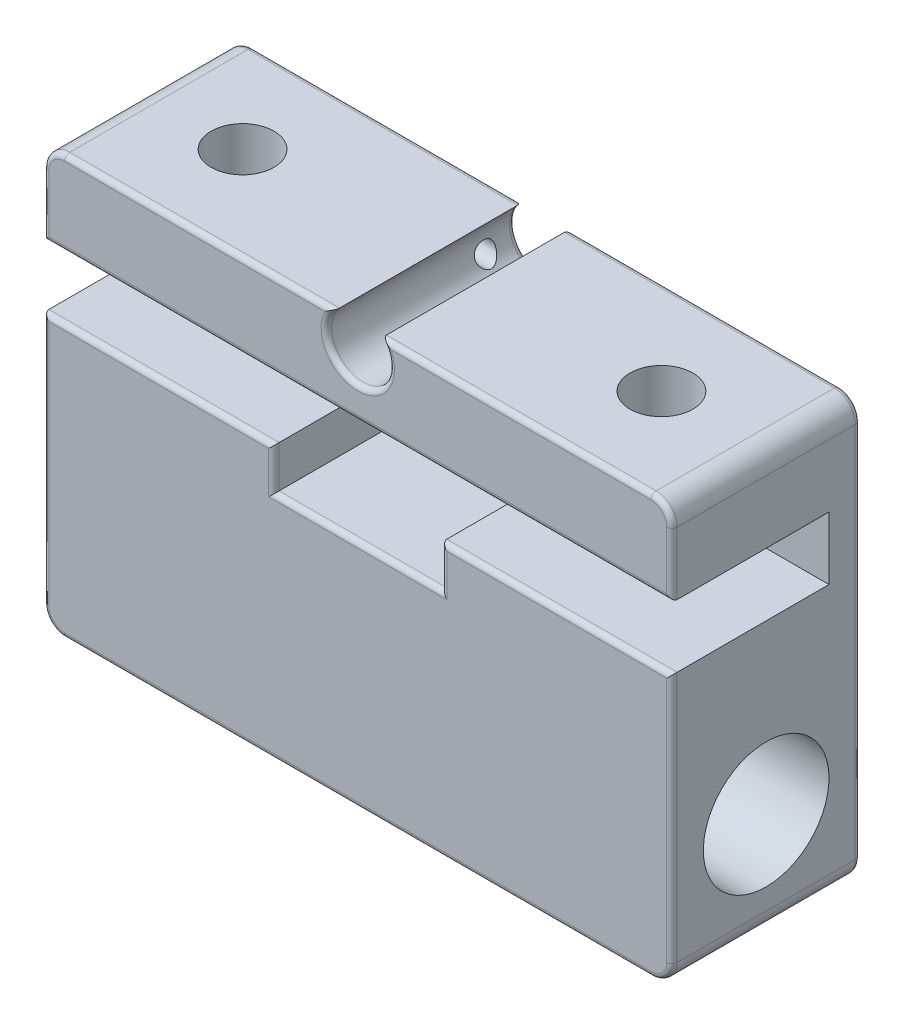
from build123d import *

# Parameters (mm, degrees)
SKETCH1_W           = 60
SKETCH1_H           = 40
BOSS_EXTRUDE1_DEPTH = 9
SKETCH2_R           = 6
CUT_EXTRUDE1_DEPTH  = 64.882705015
SKETCH3_R           = 3
CUT_EXTRUDE2_DEPTH  = 41.298883359
CUT_EXTRUDE3_DEPTH  = 15
SKETCH5_R           = 1
CUT_EXTRUDE4_DEPTH  = 29
SKETCH6_R           = 1.5
CUT_EXTRUDE5_DEPTH  = 5
CUT_EXTRUDE6_REACH  = 52.804
SKETCH7_R           = 2
SKETCH8_R           = 3
CUT_EXTRUDE7_DEPTH  = 5
FILLET1_R           = 2
FILLET2_R           = 0.5


with BuildPart() as part:
    # Sketch1 → Boss-Extrude1 (new, symmetric)
    with BuildSketch(Plane.XY):
        Rectangle(SKETCH1_W, SKETCH1_H)
    extrude(amount=BOSS_EXTRUDE1_DEPTH, both=True)

    # Sketch2 → Cut-Extrude1 (cut, through all)
    with BuildSketch(Plane.ZY.offset(30)):
        with Locations(Location((0, -10, 0), (0, 0, 270))):
            Circle(SKETCH2_R)
    extrude(amount=-CUT_EXTRUDE1_DEPTH, mode=Mode.SUBTRACT)

    # Sketch3 → Cut-Extrude2 (cut, through all)
    with BuildSketch(Plane.XY.offset(9)):
        with Locations((0, 18)):
            Circle(SKETCH3_R)
    extrude(amount=-CUT_EXTRUDE2_DEPTH, mode=Mode.SUBTRACT)

    # Sketch4 → Cut-Extrude3 (cut)
    with BuildSketch(Plane.XY.offset(9)):
        Polygon((-30, 12), (30, 12), (30, 6), (8, 6), (8, 2), (-8, 2), (-8, 6), (-30, 6), align=None)
    extrude(amount=-CUT_EXTRUDE3_DEPTH, mode=Mode.SUBTRACT)

    # Sketch5 → Cut-Extrude4 (cut)
    with BuildSketch(Plane.ZY.offset(30)):
        with Locations(Location((-6, 17, 0), (0, 0, 270))):
            Circle(SKETCH5_R)
    extrude(amount=-CUT_EXTRUDE4_DEPTH, mode=Mode.SUBTRACT)

    # Sketch6 → Cut-Extrude5 (cut)
    with BuildSketch(Plane.ZY.offset(30)):
        with Locations(Location((-6, 17, 0), (0, 0, 270))):
            Circle(SKETCH6_R)
    extrude(amount=-CUT_EXTRUDE5_DEPTH, mode=Mode.SUBTRACT)

    # Sketch7 → Cut-Extrude6 (cut, up to next)
    with BuildSketch(Plane(origin=(0, 20, 0), x_dir=(1, 0, 0), z_dir=(0, 1, 0)), mode=Mode.PRIVATE) as cut_extrude6_sk1:
        with Locations(Location((-20, 0, 0), (0, 0, 270))):
            Circle(SKETCH7_R)
    cut_extrude6_tool1 = extrude(cut_extrude6_sk1.sketch, amount=-CUT_EXTRUDE6_REACH, mode=Mode.PRIVATE) & part.part
    # Sketch7 → Cut-Extrude6 (cut, up to next)
    with BuildSketch(Plane(origin=(0, 20, 0), x_dir=(1, 0, 0), z_dir=(0, 1, 0)), mode=Mode.PRIVATE) as cut_extrude6_sk2:
        with Locations(Location((20, 0, 0), (0, 0, 270))):
            Circle(SKETCH7_R)
    cut_extrude6_tool2 = extrude(cut_extrude6_sk2.sketch, amount=-CUT_EXTRUDE6_REACH, mode=Mode.PRIVATE) & part.part
    add(cut_extrude6_tool1.solids().sort_by_distance((-20, 20, 0))[0], mode=Mode.SUBTRACT)
    add(cut_extrude6_tool2.solids().sort_by_distance((20, 20, 0))[0], mode=Mode.SUBTRACT)

    # Sketch8 → Cut-Extrude7 (cut)
    with BuildSketch(Plane(origin=(0, 20, 0), x_dir=(1, 0, 0), z_dir=(0, 1, 0))):
        with Locations(Location((-20, 0, 0), (0, 0, 270))):
            Circle(SKETCH8_R)
        with Locations(Location((20, 0, 0), (0, 0, 90))):
            Circle(SKETCH8_R)
    extrude(amount=-CUT_EXTRUDE7_DEPTH, mode=Mode.SUBTRACT)

    # Fillet1
    # the kernel refuses this fillet: 2 mm, written as the material it takes off along each edge
    with BuildSketch(Plane(origin=(30, -20, 14), x_dir=(-1, 0, 0), z_dir=(0, 0, -1))) as fillet1_piece_1:
        with BuildLine():
            CenterArc((FILLET1_R, FILLET1_R), FILLET1_R, 180, 90)
            Line((0, FILLET1_R), (0, 0))
            Line((0, 0), (FILLET1_R, 0))
        make_face()
    extrude(amount=28, mode=Mode.SUBTRACT)
    with BuildSketch(Plane(origin=(-30, -20, -14), x_dir=(0, 1, 0), z_dir=(0, 0, 1)), Plane(origin=(-30, 20, -14), x_dir=(1, 0, 0), z_dir=(0, 0, 1)), Plane(origin=(30, 20, 14), x_dir=(-1, 0, 0), z_dir=(0, 0, -1))) as fillet1_piece_2:
        with BuildLine():
            CenterArc((FILLET1_R, -FILLET1_R), FILLET1_R, 90, 90)
            Line((0, -FILLET1_R), (0, 0))
            Line((0, 0), (FILLET1_R, 0))
        make_face()
    extrude(amount=28, mode=Mode.SUBTRACT)

    # Fillet2
    fillet2_edges = [part.edges().sort_by_distance(p)[0] for p in [
        (29.414213562, -19.414213562, 9),
        (15.118033989, 20, 9),
        (-30, 15, 9),
        (-29.414213562, 19.414213562, 9),
        (29.414213562, 19.414213562, 9),
        (-15.118033989, 20, -9),
        (0, 15, -9),
        (-15.118033989, 20, 9),
        (0, 15, 9),
        (-30, -6, 9),
        (30, 15, 9),
        (-19, 6, 9),
        (-8, 4, 9),
        (0, 2, 9),
        (8, 4, 9),
        (19, 6, 9),
        (0, 12, 9),
        (30, -6, 9),
        (30, 0, -9),
        (15.118033989, 20, -9),
        (0, -20, -9),
        (-30, 0, -9),
        (-29.414213562, 19.414213562, -9),
        (-29.414213562, -19.414213562, -9),
        (29.414213562, 19.414213562, -9),
        (29.414213562, -19.414213562, -9),
        (0, -20, 9),
        (-29.414213562, -19.414213562, 9),
    ]]
    fillet(fillet2_edges, radius=FILLET2_R)


solid = part.part
